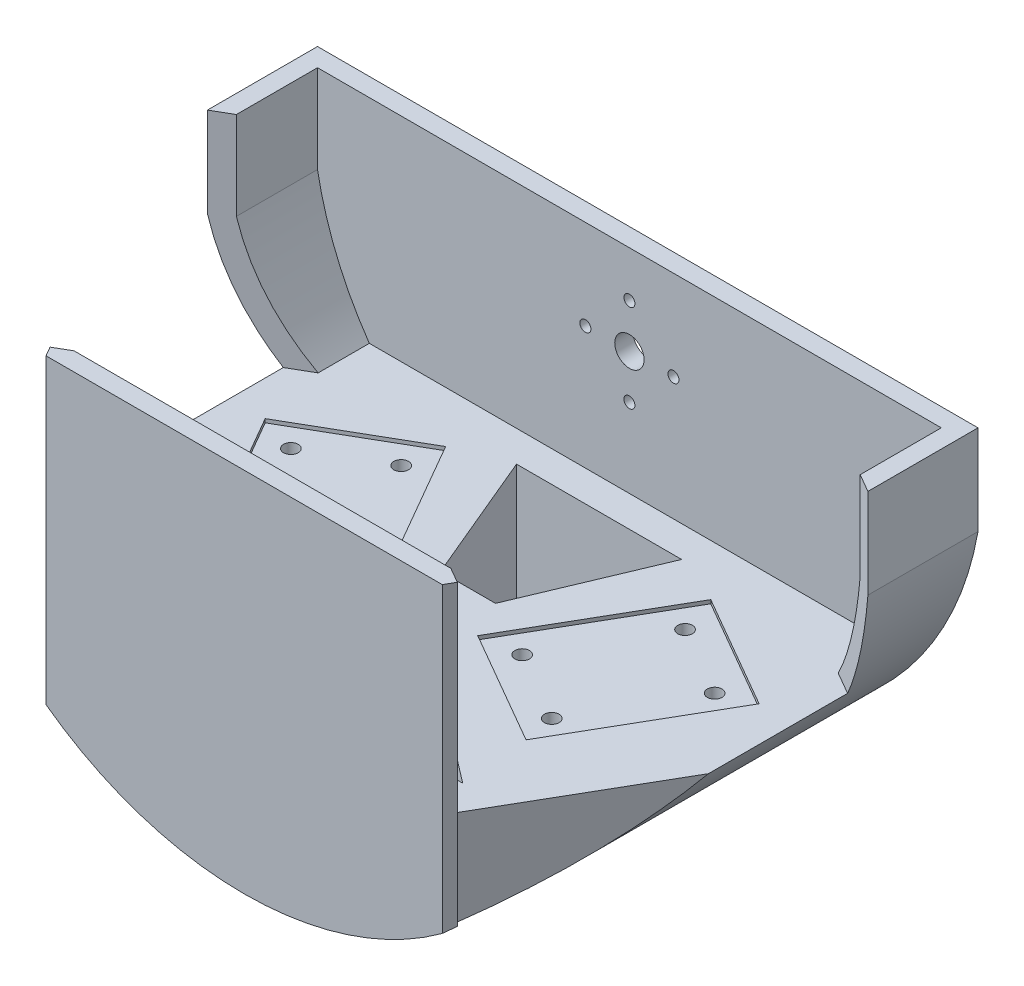
from build123d import *

# Parameters (mm, degrees)
BOSS_EXTRUDE1_DEPTH      = 50
BOSS_EXTRUDE1_DEPTH_BACK = 50
CUT_EXTRUDE1_DEPTH       = 151.665191733
SHELL1_T                 = -5
CUT_EXTRUDE2_START       = -5
CUT_EXTRUDE2_OUTLINE_W   = 65
CUT_EXTRUDE2_OUTLINE_H   = 87
CUT_EXTRUDE2_DEPTH       = 5
BOSS_EXTRUDE3_REACH      = 149.054
SKETCH6_R                = 2
CUT_EXTRUDE4_DEPTH       = 121.370262108
SKETCH6_4_R              = 2
CUT_EXTRUDE5_DEPTH       = 1
CUT_EXTRUDE6_DEPTH       = 31
SKETCH11_R               = 4
SKETCH11_R_2             = 1.5
CUT_EXTRUDE7_DEPTH       = 31
SKETCH12_R               = 4.5
CUT_EXTRUDE8_DEPTH       = 28
CUT_EXTRUDE10_REACH      = 122.37
CUT_EXTRUDE10_END_RADIUS = 86.3884
SKETCH14_W               = 15
SKETCH14_H               = 35.732848509
SKETCH14_W_2             = 30
SKETCH14_H_2             = 22.886792525
CUT_EXTRUDE11_REACH      = 147.344


# Read off the part's stored shape, not the designer's step: Cut-Extrude2
with BuildPart() as part:
    # Sketch2 → Boss-Extrude1 (new, two sides: drawn at the far end of the back side and taken through both)
    with BuildSketch(Plane(origin=(0, 0, 0), x_dir=(1, 0, 0), z_dir=(0, 1, 0)).offset(-BOSS_EXTRUDE1_DEPTH_BACK)):
        Polygon((-90, 7.353829072), (-54, -55), (54, -55), (90, 7.353829072), (90, 55), (-90, 55), align=None)
    extrude(amount=BOSS_EXTRUDE1_DEPTH + BOSS_EXTRUDE1_DEPTH_BACK)

    # Sketch3 → Cut-Extrude1 (cut, through all)
    with BuildSketch(Plane(origin=(0, 0, -55), x_dir=(-1, 0, 0), z_dir=(0, 0, -1))):
        with BuildLine():
            ThreePointArc((4.5e-08, -50), (-58.743320462, -28.619184987), (-90, 25.518943344))
            Line((-90, 25.518943344), (-90, -50))
            Line((-90, -50), (4.5e-08, -50))
        make_face()
        with BuildLine():
            ThreePointArc((90, 25.518943344), (58.743320497, -28.619184957), (4.5e-08, -50))
            Line((4.5e-08, -50), (90, -50))
            Line((90, -50), (90, 25.518943344))
        make_face()
    extrude(amount=-CUT_EXTRUDE1_DEPTH, mode=Mode.SUBTRACT)

    # Shell1
    shell1_openings = [part.faces().sort_by_distance(p)[0] for p in [
        (0, 50, -4.375017638),
    ]]
    offset(amount=SHELL1_T, openings=shell1_openings, kind=Kind.INTERSECTION)

    # Cut-Extrude2 outline → Cut-Extrude2 (cut)
    with BuildSketch(Plane(origin=(-64.315698604, 0, 37.132685902), x_dir=(0.500000000000001, 0, 0.8660254037844382), z_dir=(-0.866025403784438, 0, 0.5000000000000009)).offset(CUT_EXTRUDE2_START)):
        with Locations((-14.868602792, 6.5)):
            Rectangle(CUT_EXTRUDE2_OUTLINE_W, CUT_EXTRUDE2_OUTLINE_H)
    cut_extrude2 = extrude(amount=CUT_EXTRUDE2_DEPTH, mode=Mode.SUBTRACT)

    # Mirror1: Cut-Extrude2 across plane
    add(cut_extrude2.mirror(Plane(origin=(0, 0, 0), x_dir=(0, 0, 1), z_dir=(1, 0, 0))), mode=Mode.SUBTRACT)

    # Boss-Extrude3: up to this face of the body (flat: up to its plane)
    boss_extrude3_end = Plane(part.part.faces().sort_by_distance((0, 5.038192354, 50))[0])
    # Sketch8 → Boss-Extrude3 (add, up to the picked face)
    with BuildSketch(Plane.XY.offset(-50), mode=Mode.PRIVATE) as boss_extrude3_sk1:
        with BuildLine():
            Line((76.893599213, -8), (-76.893599213, -8))
            ThreePointArc((-76.893599213, -8), (0, -50), (76.893599213, -8))
        make_face()
    boss_extrude3_tool1 = split(extrude(boss_extrude3_sk1.sketch, amount=BOSS_EXTRUDE3_REACH, mode=Mode.PRIVATE), bisect_by=boss_extrude3_end, keep=Keep.BOTH, mode=Mode.PRIVATE)
    add(boss_extrude3_tool1.solids().sort_by(Axis((0, -25.182235, -50), (0, 0, 1)))[0])

    # Sketch6 → Cut-Extrude4 (cut, through all)
    with BuildSketch(Plane(origin=(0, -8, 0), x_dir=(1, 0, 0), z_dir=(0, 1, 0))):
        with Locations(Location((-57.742314098, 15.481878155, 0), (0, 0, 270))):
            Circle(SKETCH6_R)
        with Locations(Location((-38.689755215, 26.481878155, 0), (0, 0, 270))):
            Circle(SKETCH6_R)
        with Locations(Location((-41.492314098, -12.663947468, 0), (0, 0, 270))):
            Circle(SKETCH6_R)
        with Locations(Location((-22.439755215, -1.663947468, 0), (0, 0, 270))):
            Circle(SKETCH6_R)
        with Locations(Location((22.439755215, -1.663947468, 0), (0, 0, 270))):
            Circle(SKETCH6_R)
        with Locations(Location((41.492314098, -12.663947468, 0), (0, 0, 270))):
            Circle(SKETCH6_R)
        with Locations(Location((38.689755215, 26.481878155, 0), (0, 0, 270))):
            Circle(SKETCH6_R)
        with Locations(Location((57.742314098, 15.481878155, 0), (0, 0, 270))):
            Circle(SKETCH6_R)
    extrude(amount=-CUT_EXTRUDE4_DEPTH, mode=Mode.SUBTRACT)

    # Sketch6<4> → Cut-Extrude5 (cut)
    # profile 1 of 2: a face of its own
    with BuildSketch(Plane(origin=(0, -8, 0), x_dir=(1, 0, 0), z_dir=(0, 1, 0))):
        Polygon((36.127577388, 36.044055982), (67.304491924, 18.044055982), (44.054491924, -22.226125294), (12.877577388, -4.226125294), align=None)
        with Locations(Location((38.689755215, 26.481878155, 0), (0, 0, 270))):
            Circle(SKETCH6_4_R, mode=Mode.SUBTRACT)
        with Locations(Location((22.439755215, -1.663947468, 0), (0, 0, 270))):
            Circle(SKETCH6_4_R, mode=Mode.SUBTRACT)
        with Locations(Location((41.492314098, -12.663947468, 0), (0, 0, 270))):
            Circle(SKETCH6_4_R, mode=Mode.SUBTRACT)
        with Locations(Location((57.742314098, 15.481878155, 0), (0, 0, 270))):
            Circle(SKETCH6_4_R, mode=Mode.SUBTRACT)
    # profile 2 of 2: a face of its own
    with BuildSketch(Plane(origin=(0, -8, 0), x_dir=(1, 0, 0), z_dir=(0, 1, 0))):
        Polygon((-36.127577388, 36.044055982), (-12.877577388, -4.226125294), (-44.054491924, -22.226125294), (-67.304491924, 18.044055982), align=None)
    extrude(amount=-CUT_EXTRUDE5_DEPTH, mode=Mode.SUBTRACT)

    # Sketch10 → Cut-Extrude6 (cut)
    with BuildSketch(Plane(origin=(0, -8, 0), x_dir=(1, 0, 0), z_dir=(0, 1, 0))):
        Polygon((-76.893599213, -5.347122994), (-51.169872981, -49.901923789), (-55.5, -52.401923789), (-56.886751346, -50), (-76.893599213, -50), align=None)
    cut_extrude6 = extrude(amount=-CUT_EXTRUDE6_DEPTH, mode=Mode.SUBTRACT)

    # Mirror2: Cut-Extrude6 across plane
    add(cut_extrude6.mirror(Plane(origin=(0, 0, 0), x_dir=(0, 0, 1), z_dir=(1, 0, 0))), mode=Mode.SUBTRACT)

    # Sketch11 → Cut-Extrude7 (cut)
    with BuildSketch(Plane(origin=(0, 0, -55), x_dir=(-1, 0, 0), z_dir=(0, 0, -1))):
        with Locations((0, 25.54)):
            Circle(SKETCH11_R)
        with Locations((-12, 25.54)):
            Circle(SKETCH11_R_2)
        with Locations((0, 37.54)):
            Circle(SKETCH11_R_2)
        with Locations((12, 25.54)):
            Circle(SKETCH11_R_2)
        with Locations((0, 13.54)):
            Circle(SKETCH11_R_2)
    extrude(amount=-CUT_EXTRUDE7_DEPTH, mode=Mode.SUBTRACT)

    # Sketch12 → Cut-Extrude8 (cut)
    with BuildSketch(Plane(origin=(0, -50, 0), x_dir=(1, 0, 0), z_dir=(0, 1, 0))):
        with Locations(Location((-41.492314098, -12.663947468, 0), (0, 0, 90))):
            Circle(SKETCH12_R)
        with Locations(Location((-57.742314098, 15.481878155, 0), (0, 0, 90))):
            Circle(SKETCH12_R)
        with Locations(Location((-38.689755215, 26.481878155, 0), (0, 0, 90))):
            Circle(SKETCH12_R)
        with Locations(Location((57.742314098, 15.481878155, 0), (0, 0, 90))):
            Circle(SKETCH12_R)
        with Locations(Location((-22.439755215, -1.663947468, 0), (0, 0, 90))):
            Circle(SKETCH12_R)
        with Locations(Location((38.689755215, 26.481878155, 0), (0, 0, 90))):
            Circle(SKETCH12_R)
        with Locations(Location((41.492314098, -12.663947468, 0), (0, 0, 90))):
            Circle(SKETCH12_R)
        with Locations(Location((22.439755215, -1.663947468, 0), (0, 0, 90))):
            Circle(SKETCH12_R)
    extrude(amount=CUT_EXTRUDE8_DEPTH, mode=Mode.SUBTRACT)

    # Cut-Extrude10: up to this cylinder (the profile starts inside it)
    cut_extrude10_end = Plane(origin=(0, 41.3884, 1.910921), z_dir=(0, 0, -1)) * Cylinder(CUT_EXTRUDE10_END_RADIUS, 481.618704, mode=Mode.PRIVATE)
    # Sketch14 → Cut-Extrude10 (cut, up to the surface)
    with BuildSketch(Plane(origin=(0, -8, 0), x_dir=(1, 0, 0), z_dir=(0, 1, 0)), mode=Mode.PRIVATE) as cut_extrude10_sk1:
        Polygon((-22.317136957, 41.550980906), (-7.317136957, 41.550980906), (-7.317136957, 5.818132397), align=None)
    cut_extrude10_tool1 = extrude(cut_extrude10_sk1.sketch, amount=-CUT_EXTRUDE10_REACH, mode=Mode.PRIVATE) & cut_extrude10_end
    add(cut_extrude10_tool1.solids().sort_by_distance((-12.317137, -8, -29.640031))[0], mode=Mode.SUBTRACT)
    # Sketch14 → Cut-Extrude10 (cut, up to the surface)
    with BuildSketch(Plane(origin=(0, -8, 0), x_dir=(1, 0, 0), z_dir=(0, 1, 0)), mode=Mode.PRIVATE) as cut_extrude10_sk2:
        Polygon((7.682863043, 5.818132397), (22.682863043, 41.550980906), (7.682863043, 41.550980906), align=None)
    cut_extrude10_tool2 = extrude(cut_extrude10_sk2.sketch, amount=-CUT_EXTRUDE10_REACH, mode=Mode.PRIVATE) & cut_extrude10_end
    add(cut_extrude10_tool2.solids().sort_by_distance((12.682863, -8, -29.640031))[0], mode=Mode.SUBTRACT)
    # Sketch14 → Cut-Extrude10 (cut, up to the surface)
    with BuildSketch(Plane(origin=(0, -8, 0), x_dir=(1, 0, 0), z_dir=(0, 1, 0)), mode=Mode.PRIVATE) as cut_extrude10_sk3:
        with Locations((0.182863043, 23.684556651)):
            Rectangle(SKETCH14_W, SKETCH14_H)
    cut_extrude10_tool3 = extrude(cut_extrude10_sk3.sketch, amount=-CUT_EXTRUDE10_REACH, mode=Mode.PRIVATE) & cut_extrude10_end
    add(cut_extrude10_tool3.solids().sort_by_distance((0.182863, -8, -23.684557))[0], mode=Mode.SUBTRACT)
    # Sketch14 → Cut-Extrude10 (cut, up to the surface)
    with BuildSketch(Plane(origin=(0, -8, 0), x_dir=(1, 0, 0), z_dir=(0, 1, 0)), mode=Mode.PRIVATE) as cut_extrude10_sk4:
        with Locations((0.6696167, -29.647407325)):
            Rectangle(SKETCH14_W_2, SKETCH14_H_2)
    cut_extrude10_tool4 = extrude(cut_extrude10_sk4.sketch, amount=-CUT_EXTRUDE10_REACH, mode=Mode.PRIVATE) & cut_extrude10_end
    add(cut_extrude10_tool4.solids().sort_by_distance((0.669617, -8, 29.647407))[0], mode=Mode.SUBTRACT)
    # Sketch14 → Cut-Extrude10 (cut, up to the surface)
    with BuildSketch(Plane(origin=(0, -8, 0), x_dir=(1, 0, 0), z_dir=(0, 1, 0)), mode=Mode.PRIVATE) as cut_extrude10_sk5:
        Polygon((-14.3303833, -18.204011062), (-44.3303833, -41.090803587), (-14.3303833, -41.090803587), align=None)
    cut_extrude10_tool5 = extrude(cut_extrude10_sk5.sketch, amount=-CUT_EXTRUDE10_REACH, mode=Mode.PRIVATE) & cut_extrude10_end
    add(cut_extrude10_tool5.solids().sort_by_distance((-24.330383, -8, 33.461873))[0], mode=Mode.SUBTRACT)
    # Sketch14 → Cut-Extrude10 (cut, up to the surface)
    with BuildSketch(Plane(origin=(0, -8, 0), x_dir=(1, 0, 0), z_dir=(0, 1, 0)), mode=Mode.PRIVATE) as cut_extrude10_sk6:
        Polygon((45.6696167, -41.090803587), (15.6696167, -41.090803587), (15.6696167, -18.204011062), align=None)
    cut_extrude10_tool6 = extrude(cut_extrude10_sk6.sketch, amount=-CUT_EXTRUDE10_REACH, mode=Mode.PRIVATE) & cut_extrude10_end
    add(cut_extrude10_tool6.solids().sort_by_distance((25.669617, -8, 33.461873))[0], mode=Mode.SUBTRACT)

    # Cut-Extrude11: up to this face of the body (flat: up to its plane)
    cut_extrude11_end = Plane(part.part.faces().sort_by_distance((-0.144766794, -8, -2.300716208))[0])
    # Sketch15 → Cut-Extrude11 (cut, up to the picked face)
    with BuildSketch(Plane(origin=(0, 50, 0), x_dir=(1, 0, 0), z_dir=(0, 1, 0)), mode=Mode.PRIVATE) as cut_extrude11_sk1:
        Polygon((-85, 27.886751346), (-85, 25), (85, 25), (85, 27.886751346), (46.698729811, 50), (-46.698729811, 50), align=None)
    cut_extrude11_tool1 = split(extrude(cut_extrude11_sk1.sketch, amount=-CUT_EXTRUDE11_REACH, mode=Mode.PRIVATE), bisect_by=cut_extrude11_end, keep=Keep.BOTH, mode=Mode.PRIVATE)
    # Sketch15 → Cut-Extrude11 (cut, up to the picked face)
    with BuildSketch(Plane(origin=(0, 50, 0), x_dir=(1, 0, 0), z_dir=(0, 1, 0)), mode=Mode.PRIVATE) as cut_extrude11_sk2:
        Polygon((85, 27.886751346), (85, 25), (90, 25), align=None)
    cut_extrude11_tool2 = split(extrude(cut_extrude11_sk2.sketch, amount=-CUT_EXTRUDE11_REACH, mode=Mode.PRIVATE), bisect_by=cut_extrude11_end, keep=Keep.BOTH, mode=Mode.PRIVATE)
    # Sketch15 → Cut-Extrude11 (cut, up to the picked face)
    with BuildSketch(Plane(origin=(0, 50, 0), x_dir=(1, 0, 0), z_dir=(0, 1, 0)), mode=Mode.PRIVATE) as cut_extrude11_sk3:
        Polygon((-85, 27.886751346), (-90, 25), (-85, 25), align=None)
    cut_extrude11_tool3 = split(extrude(cut_extrude11_sk3.sketch, amount=-CUT_EXTRUDE11_REACH, mode=Mode.PRIVATE), bisect_by=cut_extrude11_end, keep=Keep.BOTH, mode=Mode.PRIVATE)
    # Sketch15 → Cut-Extrude11 (cut, up to the picked face)
    with BuildSketch(Plane(origin=(0, 50, 0), x_dir=(1, 0, 0), z_dir=(0, 1, 0)), mode=Mode.PRIVATE) as cut_extrude11_sk4:
        Polygon((85, 25), (-85, 25), (-85, 8.693575035), (-83.669872981, 6.389727457), (-88, 3.889727457), (-90, 7.353829072), (-90, -17), (90, -17), (90, 7.353829072), (88, 3.889727457), (83.669872981, 6.389727457), (85, 8.693575035), align=None)
    cut_extrude11_tool4 = split(extrude(cut_extrude11_sk4.sketch, amount=-CUT_EXTRUDE11_REACH, mode=Mode.PRIVATE), bisect_by=cut_extrude11_end, keep=Keep.BOTH, mode=Mode.PRIVATE)
    # Sketch15 → Cut-Extrude11 (cut, up to the picked face)
    with BuildSketch(Plane(origin=(0, 50, 0), x_dir=(1, 0, 0), z_dir=(0, 1, 0)), mode=Mode.PRIVATE) as cut_extrude11_sk5:
        Polygon((-85, 25), (-90, 25), (-90, 7.353829072), (-88, 3.889727457), (-83.669872981, 6.389727457), (-85, 8.693575035), align=None)
    cut_extrude11_tool5 = split(extrude(cut_extrude11_sk5.sketch, amount=-CUT_EXTRUDE11_REACH, mode=Mode.PRIVATE), bisect_by=cut_extrude11_end, keep=Keep.BOTH, mode=Mode.PRIVATE)
    # Sketch15 → Cut-Extrude11 (cut, up to the picked face)
    with BuildSketch(Plane(origin=(0, 50, 0), x_dir=(1, 0, 0), z_dir=(0, 1, 0)), mode=Mode.PRIVATE) as cut_extrude11_sk6:
        Polygon((90, 25), (85, 25), (85, 8.693575035), (83.669872981, 6.389727457), (88, 3.889727457), (90, 7.353829072), align=None)
    cut_extrude11_tool6 = split(extrude(cut_extrude11_sk6.sketch, amount=-CUT_EXTRUDE11_REACH, mode=Mode.PRIVATE), bisect_by=cut_extrude11_end, keep=Keep.BOTH, mode=Mode.PRIVATE)
    add(cut_extrude11_tool1.solids().sort_by(Axis((0, 50, -36.223488), (0, -1, 0)))[0], mode=Mode.SUBTRACT)
    add(cut_extrude11_tool2.solids().sort_by(Axis((86.666667, 50, -25.96225), (0, -1, 0)))[0], mode=Mode.SUBTRACT)
    add(cut_extrude11_tool3.solids().sort_by(Axis((-86.666667, 50, -25.96225), (0, -1, 0)))[0], mode=Mode.SUBTRACT)
    add(cut_extrude11_tool4.solids().sort_by(Axis((0, 50, -3.699993), (0, -1, 0)))[0], mode=Mode.SUBTRACT)
    add(cut_extrude11_tool5.solids().sort_by(Axis((-87.416609, 50, -14.869132), (0, -1, 0)))[0], mode=Mode.SUBTRACT)
    add(cut_extrude11_tool6.solids().sort_by(Axis((87.416609, 50, -14.869132), (0, -1, 0)))[0], mode=Mode.SUBTRACT)


solid = part.part
